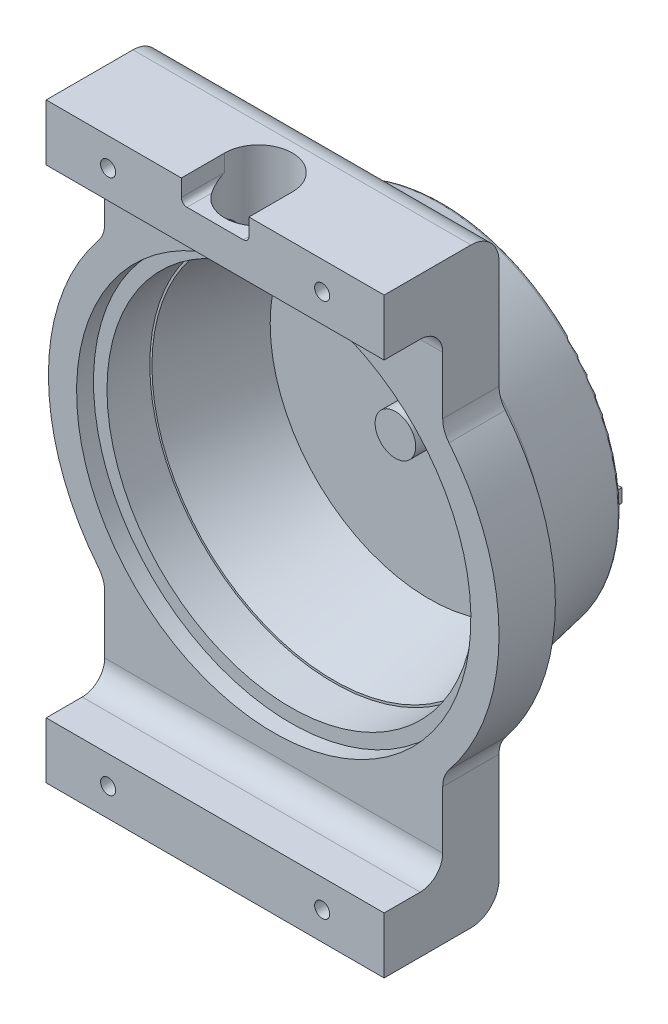
from build123d import *

# Parameters (mm, degrees)
BOSS_EXTRUDE1_DEPTH                                = 12.7
SKETCH2_W                                          = 76.2
SKETCH2_H                                          = 12.7
BOSS_EXTRUDE2_DEPTH                                = 13.208
SKETCH3_W                                          = 76.2
SKETCH3_H                                          = 12.7
BOSS_EXTRUDE3_DEPTH                                = 13.208
SKETCH4_R                                          = 45.212
BOSS_EXTRUDE4_DEPTH                                = 25.4
BOSS_EXTRUDE4_TAPER                                = 11.230895956
BOSS_EXTRUDE5_DEPTH                                = 3.048
SKETCH6_R                                          = 44.45
CUT_EXTRUDE1_DEPTH                                 = 3.81
SKETCH7_R                                          = 41.402
CUT_EXTRUDE2_DEPTH                                 = 9.652
SKETCH8_R                                          = 40.924445545
CUT_EXTRUDE3_DEPTH                                 = 21.59
CUT_EXTRUDE3_DRAFT                                 = -13.225471871
SKETCH9_W                                          = 4.572
SKETCH9_H                                          = 7.62
CBORE_FOR_M3_HEX_HEAD_MACHINE_SCREW1_D             = 3.4036
CBORE_FOR_M3_HEX_HEAD_MACHINE_SCREW1_CBORE_D       = 6.35
CBORE_FOR_M3_HEX_HEAD_MACHINE_SCREW1_CBORE_DEPTH   = 4.064
CBORE_FOR_M3_5_HEX_HEAD_MACHINE_SCREW1_D           = 4.3942
CBORE_FOR_M3_5_HEX_HEAD_MACHINE_SCREW1_DEPTH       = 6.7564
CBORE_FOR_M3_5_HEX_HEAD_MACHINE_SCREW1_CBORE_D     = 55.88
CBORE_FOR_M3_5_HEX_HEAD_MACHINE_SCREW1_CBORE_DEPTH = 3.048
HOLE2_D                                            = 12.192
HOLE2_DEPTH                                        = 51.308
FILLET1_R                                          = 1.016
FILLET2_R                                          = 5.08
FILLET3_R                                          = 6.35
CUT_EXTRUDE4_DEPTH                                 = 5.08
CUT_EXTRUDE5_REACH                                 = 1460.17
SKETCH20_R                                         = 7.62
FILLET4_R                                          = 1.27


with BuildPart() as part:
    # Sketch1 → Boss-Extrude1 (new body)
    with BuildSketch(Plane.XY.offset(1247.394)):
        with BuildLine():
            Line((632.6886, 939.980958349), (632.6886, 906.907))
            Line((632.6886, 906.907), (708.8886, 906.907))
            Line((708.8886, 906.907), (708.8886, 939.980958349))
            ThreePointArc((708.8886, 939.980958349), (721.5886, 973.582), (708.8886, 1007.183041651))
            Line((708.8886, 1007.183041651), (708.8886, 1040.257))
            Line((708.8886, 1040.257), (632.6886, 1040.257))
            Line((632.6886, 1040.257), (632.6886, 1007.183041651))
            ThreePointArc((632.6886, 1007.183041651), (619.9886, 973.582), (632.6886, 939.980958349))
        make_face()
    extrude(amount=-BOSS_EXTRUDE1_DEPTH)

    # Sketch2 → Boss-Extrude2 (add)
    with BuildSketch(Plane.XY.offset(1247.394)):
        with Locations((670.7886, 1033.907)):
            Rectangle(SKETCH2_W, SKETCH2_H)
    extrude(amount=BOSS_EXTRUDE2_DEPTH)

    # Sketch3 → Boss-Extrude3 (add)
    with BuildSketch(Plane.XY.offset(1247.394)):
        with Locations((670.7886, 913.257)):
            Rectangle(SKETCH3_W, SKETCH3_H)
    extrude(amount=BOSS_EXTRUDE3_DEPTH)

    # Sketch4 → Boss-Extrude4 (add)
    with BuildSketch(Plane(origin=(0, 0, 1234.694), x_dir=(-1, 0, 0), z_dir=(0, 0, -1))):
        with Locations((-670.7886, 973.582)):
            Circle(SKETCH4_R)
    extrude(amount=BOSS_EXTRUDE4_DEPTH, taper=BOSS_EXTRUDE4_TAPER)

    # Sketch5 → Boss-Extrude5 (add)
    with BuildSketch(Plane(origin=(0, 0, 1209.294), x_dir=(-1, 0, 0), z_dir=(0, 0, -1))):
        with BuildLine():
            Line((-708.1266, 972.058), (-708.1266, 975.106))
            Line((-708.1266, 975.106), (-702.247707425, 975.106))
            ThreePointArc((-702.247707425, 975.106), (-639.2926, 973.582), (-702.247707425, 972.058))
            Line((-702.247707425, 972.058), (-708.1266, 972.058))
        make_face()
    extrude(amount=BOSS_EXTRUDE5_DEPTH)

    # Sketch6 → Cut-Extrude1 (cut)
    with BuildSketch(Plane.XY.offset(1247.394)):
        with Locations(Location((670.7886, 973.582, 0), (0, 0, 180))):
            Circle(SKETCH6_R)
    extrude(amount=-CUT_EXTRUDE1_DEPTH, mode=Mode.SUBTRACT)

    # Sketch7 → Cut-Extrude2 (cut)
    with BuildSketch(Plane.XY.offset(1243.584)):
        with Locations(Location((670.7886, 973.582, 0), (0, 0, 180))):
            Circle(SKETCH7_R)
    extrude(amount=-CUT_EXTRUDE2_DEPTH, mode=Mode.SUBTRACT)


with BuildPart() as cut_extrude3_tool:
    # Sketch8 → Cut-Extrude3 (with draft: the straight prism first)
    with BuildSketch(Plane.XY.offset(1233.932)):
        with Locations((670.7886, 973.582)):
            Circle(SKETCH8_R)
    extrude(amount=-CUT_EXTRUDE3_DEPTH)
    # Cut-Extrude3: the draft: its side faces are tilted about the plane it starts from
    cut_extrude3_sides = [cut_extrude3_tool.faces().sort_by_distance(p)[0] for p in [
        (629.864154455, 973.582, 1223.137),
    ]]
    draft(cut_extrude3_sides, Plane.XY.offset(1233.932), CUT_EXTRUDE3_DRAFT)


with BuildPart() as part_1:
    add(part.part)

    # Cut-Extrude3: cut by cut_extrude3_tool
    add(cut_extrude3_tool.part, mode=Mode.SUBTRACT)

    # Sketch9 → Revolve1 (revolve)
    with BuildSketch(Plane.XZ.offset(-973.582), mode=Mode.PRIVATE) as revolve1_sk:
        with Locations((673.0746, 1216.152)):
            Rectangle(SKETCH9_W, SKETCH9_H)
    revolve(revolve1_sk.sketch.rotate(Axis((670.7886, 973.582, 1219.962), (0, 0, -1)), 180), axis=Axis((670.7886, 973.582, 1219.962), (0, 0, -1)))

    # CBORE for M3 Hex Head Machine Screw1 (through all)
    with Locations(Plane(origin=(0, 0, 1234.694), x_dir=(-1, 0, 0), z_dir=(0, 0, -1))):
        with Locations((-694.9186, 1033.907), (-646.6586, 1033.907), (-694.9186, 913.257), (-646.6586, 913.257)):
            CounterBoreHole(CBORE_FOR_M3_HEX_HEAD_MACHINE_SCREW1_D / 2, CBORE_FOR_M3_HEX_HEAD_MACHINE_SCREW1_CBORE_D / 2, CBORE_FOR_M3_HEX_HEAD_MACHINE_SCREW1_CBORE_DEPTH)

    # CBORE for M3.5 Hex Head Machine Screw1
    with Locations(Plane(origin=(0, 0, 1206.246), x_dir=(-1, 0, 0), z_dir=(0, 0, -1))):
        with Locations((-670.7886, 973.582)):
            CounterBoreHole(CBORE_FOR_M3_5_HEX_HEAD_MACHINE_SCREW1_D / 2, CBORE_FOR_M3_5_HEX_HEAD_MACHINE_SCREW1_CBORE_D / 2, CBORE_FOR_M3_5_HEX_HEAD_MACHINE_SCREW1_CBORE_DEPTH, depth=CBORE_FOR_M3_5_HEX_HEAD_MACHINE_SCREW1_DEPTH)

    # Hole2
    with Locations(Plane(origin=(0, 0, 1209.294), x_dir=(-1, 0, 0), z_dir=(0, 0, -1))):
        with Locations((-670.7886, 995.172)):
            Hole(HOLE2_D / 2, depth=HOLE2_DEPTH)

    # Fillet1
    fillet1_edges = [part_1.edges().sort_by_distance(p)[0] for p in [
        (710.957029457, 973.582, 1209.294),
    ]]
    fillet(fillet1_edges, radius=FILLET1_R)

    # Fillet2
    fillet2_edges = [part_1.edges().sort_by_distance(p)[0] for p in [
        (670.7886, 1027.557, 1247.394),
        (670.7886, 919.607, 1247.394),
    ]]
    fillet(fillet2_edges, radius=FILLET2_R)

    # Fillet3
    # the kernel refuses this fillet: 6.35 mm, written as the material it adds along each edge
    with BuildSketch(Plane(origin=(632.6886, 1007.183041651, 1247.394), x_dir=(-0.645138115564499, -0.7640659734904358, 0), z_dir=(0, 0, -1))) as fillet3_piece_1:
        with BuildLine():
            CenterArc((2.324007091, 6.348528285), FILLET3_R, 229.823968311, 38.942441269)
            Line((-1.772619942, 1.496709354), (0, 0))
            ThreePointArc((0, 0), (1.093650396, 0.011773719), (2.187300792, 0))
        make_face()
    extrude(amount=12.7)
    with BuildSketch(Plane(origin=(708.8886, 1007.183041651, 1247.394), x_dir=(0, 1, 0), z_dir=(0, 0, -1)), Plane(origin=(632.6886, 939.980958349, 1247.394), x_dir=(0, -1, 0), z_dir=(0, 0, -1))) as fillet3_piece_2:
        with BuildLine():
            CenterArc((2.319982834, 6.35), FILLET3_R, 231.057558731, 38.942441269)
            ThreePointArc((-1.671242109, 1.411111111), (-0.82802538, 0.714551453), (0, 0))
            Line((0, 0), (2.319982834, 0))
        make_face()
    extrude(amount=12.7)
    with BuildSketch(Plane(origin=(708.8886, 939.980958349, 1247.394), x_dir=(0, -1, 0), z_dir=(0, 0, -1))) as fillet3_piece_3:
        with BuildLine():
            CenterArc((2.319982834, -6.35), FILLET3_R, 90, 38.942441269)
            ThreePointArc((-1.671242109, -1.411111111), (-0.82802538, -0.714551453), (0, 0))
            Line((0, 0), (2.319982834, 0))
        make_face()
    extrude(amount=12.7)
    with BuildSketch(Plane(origin=(670.7886, 973.582, 1234.694), x_dir=(-1, 0, 0), z_dir=(0, -1, 0))) as fillet3_piece_4:
        with BuildLine():
            CenterArc((45.212 + FILLET3_R * 0.820957827564, FILLET3_R), FILLET3_R, 191.230895956, 78.769104044)
            Line((45.212 - FILLET3_R * 0.159892446987, FILLET3_R * 0.805236710561), (45.212, 0))
            Line((45.212, 0), (45.212 + FILLET3_R * 0.820957827564, 0))
        make_face()
    revolve(axis=Axis((670.7886, 973.582, 1234.694), (0, 0, -1)))
    # the kernel refuses this fillet: 6.35 mm, written as the material it takes off along each edge
    with BuildSketch(Plane(origin=(616.8136, 906.907, 1234.694), x_dir=(0, 0, 1), z_dir=(1, 0, 0))) as fillet3_2_piece_1:
        with BuildLine():
            CenterArc((FILLET3_R, -FILLET3_R), FILLET3_R, 90, 90)
            Line((0, -FILLET3_R), (0, 0))
            Line((0, 0), (FILLET3_R, 0))
        make_face()
    extrude(amount=107.95, mode=Mode.SUBTRACT)
    with BuildSketch(Plane(origin=(724.7636, 1040.257, 1234.694), x_dir=(0, -1, 0), z_dir=(-1, 0, 0))) as fillet3_2_piece_2:
        with BuildLine():
            CenterArc((FILLET3_R, FILLET3_R), FILLET3_R, 180, 90)
            Line((0, FILLET3_R), (0, 0))
            Line((0, 0), (FILLET3_R, 0))
        make_face()
    extrude(amount=107.95, mode=Mode.SUBTRACT)

    # Sketch18 → Cut-Extrude4 (cut)
    with BuildSketch(Plane(origin=(0, 1040.257, 0), x_dir=(1, 0, 0), z_dir=(0, 1, 0))):
        with BuildLine():
            Line((663.1686, -1250.823), (663.1686, -1260.602))
            Line((663.1686, -1260.602), (678.4086, -1260.602))
            Line((678.4086, -1260.602), (678.4086, -1250.823))
            ThreePointArc((678.4086, -1250.823), (670.7886, -1243.203), (663.1686, -1250.823))
        make_face()
    extrude(amount=-CUT_EXTRUDE4_DEPTH, mode=Mode.SUBTRACT)

    # Sketch20 → Cut-Extrude5 (cut, up to next)
    with BuildSketch(Plane(origin=(0, 1035.177, 0), x_dir=(1, 0, 0), z_dir=(0, 1, 0)), mode=Mode.PRIVATE) as cut_extrude5_sk1:
        with Locations(Location((670.7886, -1250.823, 0), (0, 0, 192.513325363))):
            Circle(SKETCH20_R)
    cut_extrude5_tool1 = extrude(cut_extrude5_sk1.sketch, amount=-CUT_EXTRUDE5_REACH, mode=Mode.PRIVATE) & part_1.part
    add(cut_extrude5_tool1.solids().sort_by_distance((670.7886, 1035.177, 1250.823))[0], mode=Mode.SUBTRACT)

    # Fillet4
    # the kernel refuses this fillet: 1.27 mm, written as the material it adds along each edge
    with BuildSketch(Plane(origin=(678.4086, 1035.177, 1260.602), x_dir=(0, 1, 0), z_dir=(0, 0, -1))) as fillet4_piece_1_section:
        with BuildLine():
            CenterArc((FILLET4_R, -FILLET4_R), FILLET4_R, 90, 90)
            Line((0, -FILLET4_R), (0, 0))
            Line((0, 0), (FILLET4_R, 0))
        make_face()
    fillet4_piece_1 = extrude(amount=12.954, mode=Mode.PRIVATE)
    fillet4_piece_1 = fillet4_piece_1 - Plane(origin=(670.7886, 1035.477046346, 1250.823), x_dir=(-0.9762456430400507, 0, 0.21666666666868278), z_dir=(0, 1, 0)) * Cylinder(7.62, 31, mode=Mode.PRIVATE)
    add(fillet4_piece_1)
    with BuildSketch(Plane(origin=(663.1686, 1035.177, 1247.648), x_dir=(0, 1, 0), z_dir=(0, 0, 1))) as fillet4_piece_2_section:
        with BuildLine():
            CenterArc((FILLET4_R, -FILLET4_R), FILLET4_R, 90, 90)
            Line((0, -FILLET4_R), (0, 0))
            Line((0, 0), (FILLET4_R, 0))
        make_face()
    fillet4_piece_2 = extrude(amount=12.954, mode=Mode.PRIVATE)
    fillet4_piece_2 = fillet4_piece_2 - Plane(origin=(670.7886, 1035.477042519, 1250.823), x_dir=(-0.9762456430400507, 0, 0.21666666666868278), z_dir=(0, 1, 0)) * Cylinder(7.62, 31, mode=Mode.PRIVATE)
    add(fillet4_piece_2)


solid = part_1.part
